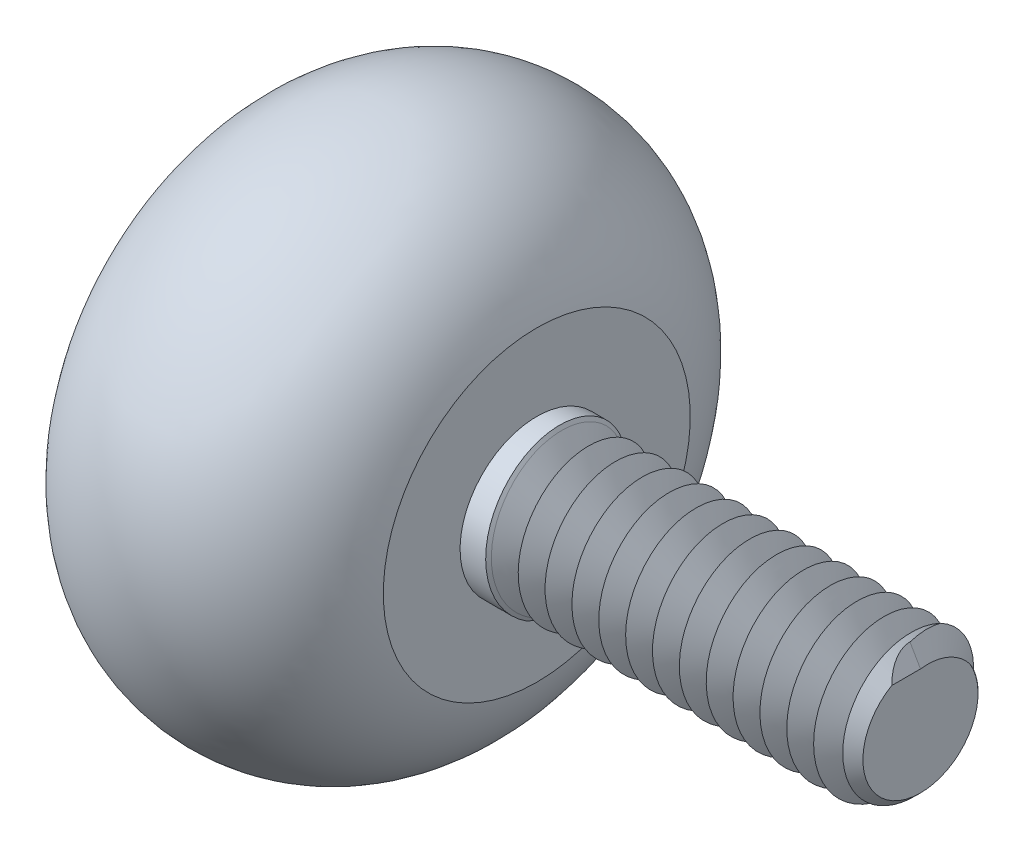
from build123d import *

# Parameters (mm, degrees)
CHAMFER1_SIZE      = 0.5
CUT_SWEEP1_PITCH   = 0.7
CUT_EXTRUDE1_DEPTH = 10
CUT_EXTRUDE2_DEPTH = 10


with BuildPart() as part:
    # Sketch1 → Revolve1 (revolve)
    with BuildSketch(Plane.XY, mode=Mode.PRIVATE) as revolve1_sk:
        with BuildLine():
            Line((9, 0), (9, 2))
            Line((9, 2), (-1, 2))
            Line((-1, 2), (-1, 4))
            ThreePointArc((-1, 4), (-5, 7.084158026), (-9, 4))
            Line((-9, 4), (-9, 0))
            Line((-9, 0), (9, 0))
        make_face()
    revolve(revolve1_sk.sketch.rotate(Axis((-9, 0, 0), (1, 0, 0)), 180), axis=Axis((-9, 0, 0), (1, 0, 0)))

    # Chamfer1
    chamfer1_edges = [part.edges().sort_by_distance(p)[0] for p in [
        (9, 2, 0),
    ]]
    chamfer(chamfer1_edges, length=CHAMFER1_SIZE)

    # Cut-Sweep1: the profile of Sketch3 screwed along a right-hand helix of 13.5 turns, 6 arcs to a turn; built about Z, then put on its axis
    cut_sweep1_z = Axis((0, 0, 0), (0, 0, 1))
    cut_sweep1_corners = [(1.3, 0, 0), (2.35, 0, -0.606217783), (2.35, 0, 0.606217783)]
    with BuildLine(mode=Mode.PRIVATE) as cut_sweep1_profile:
        Line(cut_sweep1_corners[0], cut_sweep1_corners[1])
        Line(cut_sweep1_corners[1], cut_sweep1_corners[2])
        Line(cut_sweep1_corners[2], cut_sweep1_corners[0])
    cut_sweep1_cap = Face(cut_sweep1_profile.wire())
    cut_sweep1_turn_angles = [0, 30, 60, 90, 120, 150, 180, 210, 240, 270, 300, 330, 360]
    cut_sweep1_turn_weights = [1, 0.8660254037844387, 1, 0.8660254037844387, 1, 0.8660254037844387, 1, 0.8660254037844387, 1, 0.8660254037844387, 1, 0.8660254037844387, 1]
    cut_sweep1_turn_rails = [Edge.make_bspline([Vector(p[0], p[1], 0).rotate(cut_sweep1_z, cut_sweep1_turn_angles[k]) / cut_sweep1_turn_weights[k] + Vector(0, 0, p[2] + CUT_SWEEP1_PITCH * cut_sweep1_turn_angles[k] / 360) for k in range(13)], [0, 0, 0, 1, 1, 2, 2, 3, 3, 4, 4, 5, 5, 6, 6, 6], 2, cut_sweep1_turn_weights) for p in cut_sweep1_corners]
    cut_sweep1_turn_sides = [Face.make_surface_from_curves(cut_sweep1_turn_rails[p[0]], cut_sweep1_turn_rails[p[1]]) for p in [(0, 1), (1, 2), (2, 0)]]
    cut_sweep1_turn = Solid(Shell([*cut_sweep1_turn_sides, cut_sweep1_cap, cut_sweep1_cap.rotate(cut_sweep1_z, 360).moved(Location((0, 0, CUT_SWEEP1_PITCH * 360 / 360)))]))
    cut_sweep1_last_angles = [4680, 4710, 4740, 4770, 4800, 4830, 4860]
    cut_sweep1_last_weights = [1, 0.8660254037844387, 1, 0.8660254037844387, 1, 0.8660254037843831, 1]
    cut_sweep1_last_rails = [Edge.make_bspline([Vector(p[0], p[1], 0).rotate(cut_sweep1_z, cut_sweep1_last_angles[k]) / cut_sweep1_last_weights[k] + Vector(0, 0, p[2] + CUT_SWEEP1_PITCH * cut_sweep1_last_angles[k] / 360) for k in range(7)], [0, 0, 0, 1, 1, 2, 2, 3, 3, 3], 2, cut_sweep1_last_weights) for p in cut_sweep1_corners]
    cut_sweep1_last_sides = [Face.make_surface_from_curves(cut_sweep1_last_rails[p[0]], cut_sweep1_last_rails[p[1]]) for p in [(0, 1), (1, 2), (2, 0)]]
    cut_sweep1_last = Solid(Shell([*cut_sweep1_last_sides, cut_sweep1_cap.rotate(cut_sweep1_z, 4680).moved(Location((0, 0, CUT_SWEEP1_PITCH * 4680 / 360))), cut_sweep1_cap.rotate(cut_sweep1_z, 4860).moved(Location((0, 0, CUT_SWEEP1_PITCH * 4860 / 360)))]))
    cut_sweep1_each = [*[cut_sweep1_turn.moved(Location((0, 0, CUT_SWEEP1_PITCH * i))) for i in range(13)], cut_sweep1_last]
    add(Plane(origin=(9, 0, 0), x_dir=(0, 1, 0), z_dir=(-1, 0, 0)) * Compound([cut_sweep1_each[i] for i in range(0, 14, 2)]), mode=Mode.SUBTRACT)
    add(Plane(origin=(9, 0, 0), x_dir=(0, 1, 0), z_dir=(-1, 0, 0)) * Compound([cut_sweep1_each[i] for i in range(1, 14, 2)]), mode=Mode.SUBTRACT)

    # Sketch4 → Cut-Extrude1 (cut)
    with BuildSketch(Plane(origin=(0, 0, 0), x_dir=(-1, 0, 0), z_dir=(0, 0, -1))):
        Polygon((0.154145188, -2), (0.854145188, -2), (0.8, -1.906217783), (0.45, -1.3), (0.1, -1.906217783), align=None)
    extrude(amount=-CUT_EXTRUDE1_DEPTH, mode=Mode.SUBTRACT)

    # Sketch5 → Cut-Extrude2 (cut)
    with BuildSketch(Plane(origin=(0, 0, 0), x_dir=(-1, 0, 0), z_dir=(0, 0, -1))):
        Polygon((-9, 1.3), (-8.726794919, 1.773205081), (-9, 1.5), align=None)
    extrude(amount=-CUT_EXTRUDE2_DEPTH, mode=Mode.SUBTRACT)


solid = part.part
